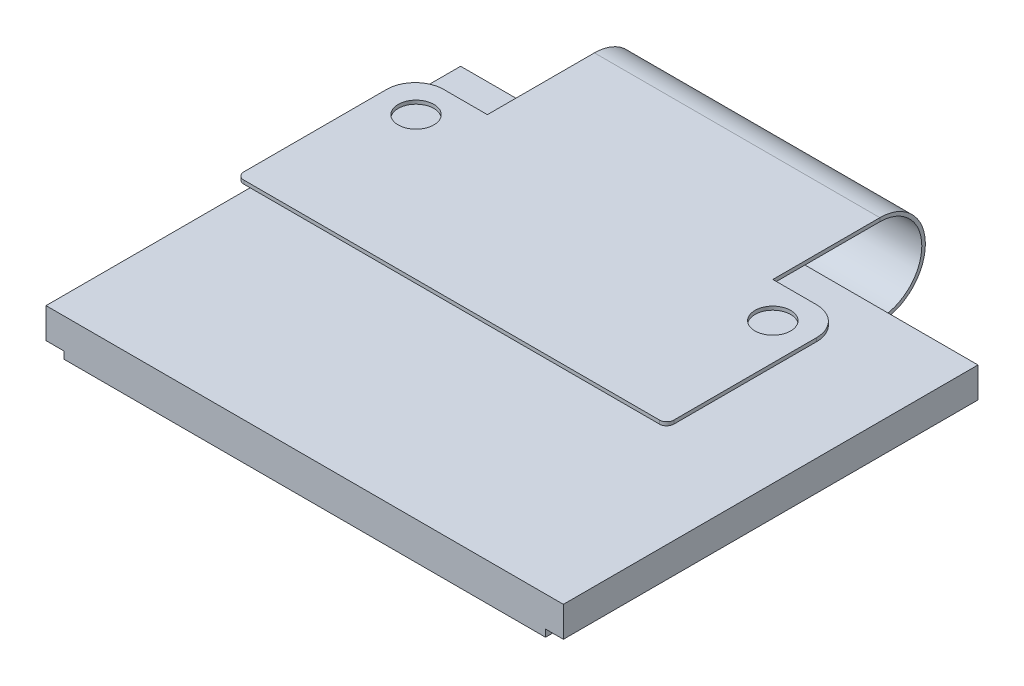
from build123d import *

# Parameters (mm, degrees)
SKETCH2_W           = 14.5
SKETCH2_H           = 11.62
BOSS_EXTRUDE1_DEPTH = 0.425
SKETCH6_W           = 13.5
SKETCH6_H           = 8.1
BOSS_EXTRUDE2_DEPTH = 0.2
BOSS_EXTRUDE4_DEPTH = 0.17547
FILLET1_R           = 0.762
FILLET2_R           = 0.2
SKETCH13_W          = 8
SKETCH13_H          = 0.1
SKETCH14_W          = 2.0249
SKETCH14_H          = 5
BOSS_EXTRUDE6_DEPTH = 0.1
SKETCH17_R          = 0.5
CUT_EXTRUDE3_DEPTH  = 0.1
FILLET3_R           = 0.2
FILLET4_R           = 0.8


with BuildPart() as part:
    # Sketch2 → Boss-Extrude1 (new, symmetric)
    with BuildSketch(Plane(origin=(0, 0, 0), x_dir=(1, 0, 0), z_dir=(0, 1, 0))):
        Rectangle(SKETCH2_W, SKETCH2_H)
    extrude(amount=BOSS_EXTRUDE1_DEPTH, both=True)

    # Sketch6 → Boss-Extrude2 (add)
    with BuildSketch(Plane.XZ.offset(0.425)):
        with Locations((0, 1.76)):
            Rectangle(SKETCH6_W, SKETCH6_H)
    extrude(amount=BOSS_EXTRUDE2_DEPTH)

    # Sketch9 → Boss-Extrude4 (add)
    with BuildSketch(Plane.XZ.offset(0.425)):
        Polygon((-6.096, -2.452696), (6.096, -2.452696), (6.096, -4.992696), (3.2893, -4.992696), (3.2893, -7.856286), (-3.2893, -7.856286), (-3.2893, -4.992696), (-6.096, -4.992696), align=None)
    extrude(amount=BOSS_EXTRUDE4_DEPTH)

    # Fillet1
    fillet1_edges = [part.edges().sort_by_distance(p)[0] for p in [
        (6.096, -0.512735, -4.992696),
        (-6.096, -0.512735, -4.992696),
    ]]
    fillet(fillet1_edges, radius=FILLET1_R)

    # Fillet2
    fillet2_edges = [part.edges().sort_by_distance(p)[0] for p in [
        (3.2893, -0.512735, -7.856286),
        (-3.2893, -0.512735, -7.856286),
    ]]
    fillet(fillet2_edges, radius=FILLET2_R)

    # Sweep2: sweep along a path in Sketch12
    with BuildLine(Plane(origin=(0, 0, 0), x_dir=(0, 0, -1), z_dir=(1, 0, 0))) as sweep2_path:
        Line((5.81, -0.425), (6.31, -0.425))
        ThreePointArc((6.31, -0.425), (7.585, 0.85), (6.31, 2.125))
        Line((6.31, 2.125), (-1.69, 2.125))
    # Sketch13 → Sweep2 (sweep)
    with BuildSketch(Plane(origin=(0, 0, -5.81), x_dir=(-1, 0, 0), z_dir=(0, 0, -1))):
        with Locations((0, -0.375)):
            Rectangle(SKETCH13_W, SKETCH13_H)
    sweep(path=sweep2_path.line)

    # Sketch14 → Boss-Extrude6 (add)
    with BuildSketch(Plane(origin=(0, 2.125, 0), x_dir=(1, 0, 0), z_dir=(0, 1, 0))):
        with Locations((-5.01245, 0.81)):
            Rectangle(SKETCH14_W, SKETCH14_H)
        with Locations((5.01245, 0.81)):
            Rectangle(SKETCH14_W, SKETCH14_H)
    extrude(amount=-BOSS_EXTRUDE6_DEPTH)

    # Sketch17 → Cut-Extrude3 (cut)
    with BuildSketch(Plane(origin=(0, 2.125, 0), x_dir=(1, 0, 0), z_dir=(0, 1, 0))):
        with Locations((-5, 2.31)):
            Circle(SKETCH17_R)
        with Locations((5, 2.31)):
            Circle(SKETCH17_R)
    extrude(amount=-CUT_EXTRUDE3_DEPTH, mode=Mode.SUBTRACT)

    # Fillet3
    fillet3_edges = [part.edges().sort_by_distance(p)[0] for p in [
        (6.0249, 2.075, 1.69),
        (-6.0249, 2.075, 1.69),
    ]]
    fillet(fillet3_edges, radius=FILLET3_R)

    # Fillet4
    fillet4_edges = [part.edges().sort_by_distance(p)[0] for p in [
        (6.0249, 2.075, -3.31),
        (-6.0249, 2.075, -3.31),
    ]]
    fillet(fillet4_edges, radius=FILLET4_R)


solid = part.part
